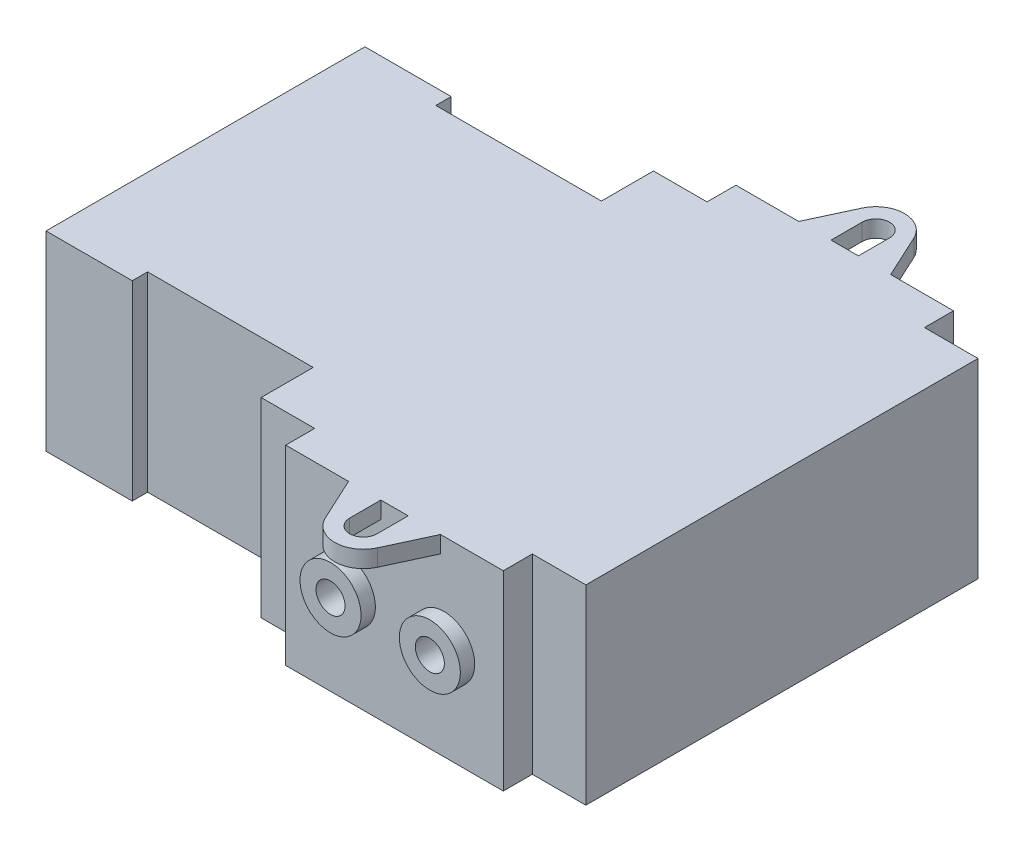
from build123d import *

# Parameters (mm, degrees)
BOSS_EXTRUDE1_DEPTH = 23.0378
SKETCH2_R           = 3.683
BOSS_EXTRUDE2_DEPTH = 1.7272
SKETCH3_R           = 1.7526
CUT_EXTRUDE1_DEPTH  = 72.299953583
BOSS_EXTRUDE3_DEPTH = 2.032


with BuildPart() as part:
    # Sketch1 → Boss-Extrude1 (new body)
    with BuildSketch(Plane(origin=(0, 0, 0), x_dir=(1, 0, 0), z_dir=(0, 1, 0))):
        Polygon((-34.798, 19.2532), (-24.384, 19.2532), (-24.384, 17.399), (-4.3942, 17.399), (-4.3942, 23.684705806), (2.0701, 23.684705806), (2.0701, 27.178), (28.3337, 27.178), (28.3337, 23.6728), (34.798, 23.6728), (34.798, -23.6728), (28.3337, -23.6728), (28.3337, -27.178), (2.0701, -27.178), (2.0701, -23.684705806), (-4.3942, -23.684705806), (-4.3942, -17.399), (-24.384, -17.399), (-24.384, -19.2532), (-34.798, -19.2532), align=None)
    extrude(amount=BOSS_EXTRUDE1_DEPTH)

    # Sketch2 → Boss-Extrude2 (add)
    with BuildSketch(Plane.XY.offset(27.178)):
        with Locations((21.1963, 11.5189)):
            Circle(SKETCH2_R)
        with Locations((9.2075, 11.5189)):
            Circle(SKETCH2_R)
    boss_extrude2 = extrude(amount=BOSS_EXTRUDE2_DEPTH)

    # Mirror1: Boss-Extrude2 across plane
    add(boss_extrude2.mirror(Plane.XY))

    # Sketch3 → Cut-Extrude1 (cut, through all)
    with BuildSketch(Plane.XY.offset(28.9052)):
        with Locations((21.1963, 11.5189)):
            Circle(SKETCH3_R)
        with Locations((9.2075, 11.5189)):
            Circle(SKETCH3_R)
    extrude(amount=-CUT_EXTRUDE1_DEPTH, mode=Mode.SUBTRACT)

    # Sketch4 → Boss-Extrude3 (add)
    with BuildSketch(Plane(origin=(0, 23.0378, 0), x_dir=(1, 0, 0), z_dir=(0, 1, 0))):
        with BuildLine():
            Line((13.5509, -27.178), (9.652, -27.178))
            Line((9.652, -27.178), (12.067809158, -32.389905736))
            ThreePointArc((12.067809158, -32.389905736), (15.2019, -34.3916), (18.335990842, -32.389905736))
            Line((18.335990842, -32.389905736), (20.7518, -27.178))
            Line((20.7518, -27.178), (16.8529, -27.178))
            Line((16.8529, -27.178), (16.8529, -30.9372))
            ThreePointArc((16.8529, -30.9372), (15.2019, -32.5882), (13.5509, -30.9372))
            Line((13.5509, -30.9372), (13.5509, -27.178))
        make_face()
        with BuildLine():
            Line((16.8529, 30.9372), (16.8529, 27.178))
            Line((16.8529, 27.178), (20.7518, 27.178))
            Line((20.7518, 27.178), (18.335990842, 32.389905736))
            ThreePointArc((18.335990842, 32.389905736), (15.2019, 34.3916), (12.067809158, 32.389905736))
            Line((12.067809158, 32.389905736), (9.652, 27.178))
            Line((9.652, 27.178), (13.5509, 27.178))
            Line((13.5509, 27.178), (13.5509, 30.9372))
            ThreePointArc((13.5509, 30.9372), (15.2019, 32.5882), (16.8529, 30.9372))
        make_face()
    extrude(amount=-BOSS_EXTRUDE3_DEPTH)


solid = part.part
